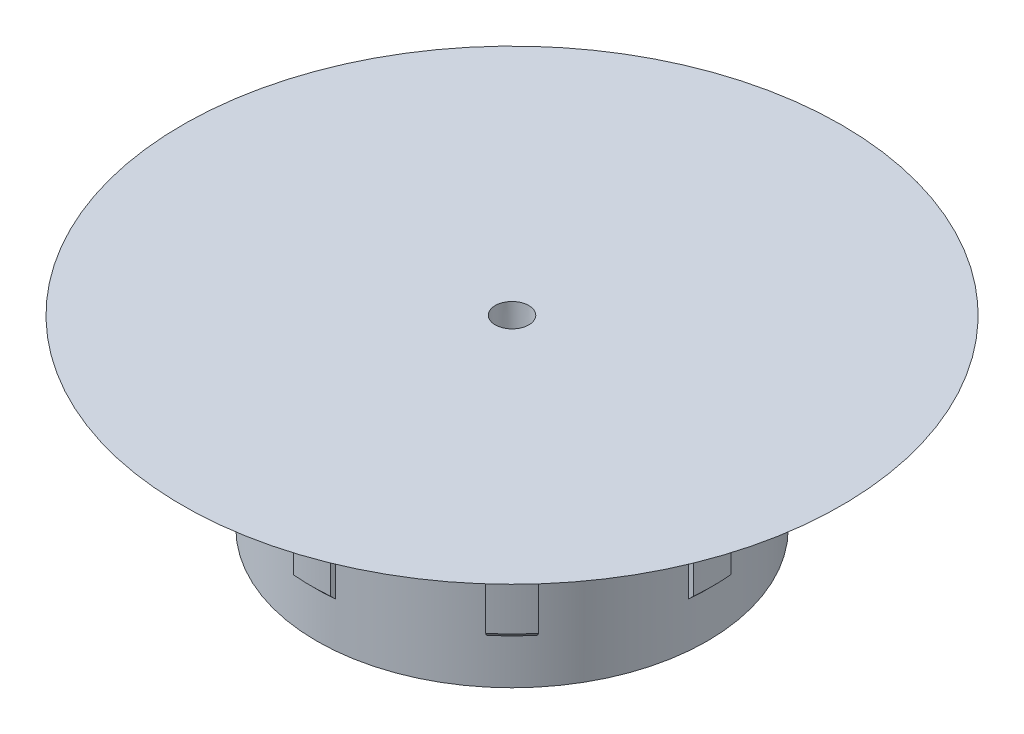
from build123d import *

# Parameters (mm, degrees)
SKETCH1_W          = 23.2283
SKETCH1_H          = 15.24
CUT_EXTRUDE1_START = -15.24
CUT_EXTRUDE1_DEPTH = 15.24
SKETCH3_R          = 1.6764
CUT_EXTRUDE2_DEPTH = 15.24
CUT_EXTRUDE3_START = -5.08
SKETCH4_R          = 23.2283
SKETCH4_R_2        = 22.5806
CUT_EXTRUDE3_DEPTH = 5.08
CHAMFER1_SIZE      = 0.762
DRAFT1_ANGLE       = 1


with BuildPart() as part:
    # Sketch1 → Revolve1 (revolve)
    with BuildSketch(Plane.XY, mode=Mode.PRIVATE) as revolve1_sk:
        with Locations((11.61415, 7.62)):
            Rectangle(SKETCH1_W, SKETCH1_H)
        Polygon((0, 21.336), (0, 15.24), (23.2283, 15.24), (38.1, 21.336), align=None)
    revolve(revolve1_sk.sketch.rotate(Axis((0, 0, 0), (0, 1, 0)), 90), axis=Axis((0, 0, 0), (0, 1, 0)))

    # Sketch2 → Cut-Extrude1 (cut)
    with BuildSketch(Plane.XZ.offset(CUT_EXTRUDE1_START)):
        with BuildLine():
            Line((2.159, 23.127746105), (2.09879825, 22.482849959))
            ThreePointArc((2.09879825, 22.482849959), (8.641221513, 20.861754172), (14.413701191, 17.381850141))
            Line((14.413701191, 17.381850141), (14.827142564, 17.880429645))
            ThreePointArc((14.827142564, 17.880429645), (8.889085572, 21.460150945), (2.159, 23.127746105))
        make_face()
        with BuildLine():
            ThreePointArc((-14.413701191, 17.381850141), (-8.641221513, 20.861754172), (-2.09879825, 22.482849959))
            Line((-2.09879825, 22.482849959), (-2.159, 23.127746105))
            ThreePointArc((-2.159, 23.127746105), (-8.889085572, 21.460150945), (-14.827142564, 17.880429645))
            Line((-14.827142564, 17.880429645), (-14.413701191, 17.381850141))
        make_face()
        with BuildLine():
            Line((-23.127746105, 2.159), (-22.482849959, 2.09879825))
            ThreePointArc((-22.482849959, 2.09879825), (-20.861754172, 8.641221513), (-17.381850141, 14.413701191))
            Line((-17.381850141, 14.413701191), (-17.880429645, 14.827142564))
            ThreePointArc((-17.880429645, 14.827142564), (-21.460150945, 8.889085572), (-23.127746105, 2.159))
        make_face()
        with BuildLine():
            Line((-17.880429645, -14.827142564), (-17.381850141, -14.413701191))
            ThreePointArc((-17.381850141, -14.413701191), (-20.861754172, -8.641221513), (-22.482849959, -2.09879825))
            Line((-22.482849959, -2.09879825), (-23.127746105, -2.159))
            ThreePointArc((-23.127746105, -2.159), (-21.460150945, -8.889085572), (-17.880429645, -14.827142564))
        make_face()
        with BuildLine():
            Line((-2.159, -23.127746105), (-2.09879825, -22.482849959))
            ThreePointArc((-2.09879825, -22.482849959), (-8.641221513, -20.861754172), (-14.413701191, -17.381850141))
            Line((-14.413701191, -17.381850141), (-14.827142564, -17.880429645))
            ThreePointArc((-14.827142564, -17.880429645), (-8.889085572, -21.460150945), (-2.159, -23.127746105))
        make_face()
        with BuildLine():
            Line((14.827142564, -17.880429645), (14.413701191, -17.381850141))
            ThreePointArc((14.413701191, -17.381850141), (8.641221513, -20.861754172), (2.09879825, -22.482849959))
            Line((2.09879825, -22.482849959), (2.159, -23.127746105))
            ThreePointArc((2.159, -23.127746105), (8.889085572, -21.460150945), (14.827142564, -17.880429645))
        make_face()
        with BuildLine():
            Line((23.127746105, -2.159), (22.482849959, -2.09879825))
            ThreePointArc((22.482849959, -2.09879825), (20.861754172, -8.641221513), (17.381850141, -14.413701191))
            Line((17.381850141, -14.413701191), (17.880429645, -14.827142564))
            ThreePointArc((17.880429645, -14.827142564), (21.460150945, -8.889085572), (23.127746105, -2.159))
        make_face()
        with BuildLine():
            Line((17.880429645, 14.827142564), (17.381850141, 14.413701191))
            ThreePointArc((17.381850141, 14.413701191), (20.861754172, 8.641221513), (22.482849959, 2.09879825))
            Line((22.482849959, 2.09879825), (23.127746105, 2.159))
            ThreePointArc((23.127746105, 2.159), (21.460150945, 8.889085572), (17.880429645, 14.827142564))
        make_face()
    extrude(amount=CUT_EXTRUDE1_DEPTH, mode=Mode.SUBTRACT)

    # Sketch3 → Cut-Extrude2 (cut)
    with BuildSketch(Plane(origin=(0, 21.336, 0), x_dir=(1, 0, 0), z_dir=(0, 1, 0))):
        with Locations(Location((0, 0, 0), (0, 0, 270))):
            Circle(SKETCH3_R)
    extrude(amount=-CUT_EXTRUDE2_DEPTH, mode=Mode.SUBTRACT)

    # Sketch4 → Cut-Extrude3 (cut)
    with BuildSketch(Plane.XZ.offset(CUT_EXTRUDE3_START)):
        Circle(SKETCH4_R)
        with Locations(Location((0, 0, 0), (0, 0, 270))):
            Circle(SKETCH4_R_2, mode=Mode.SUBTRACT)
    extrude(amount=CUT_EXTRUDE3_DEPTH, mode=Mode.SUBTRACT)

    # Chamfer1
    # the kernel refuses this chamfer: 0.762 mm, written as the material it takes off along each edge
    with BuildSketch(Plane(origin=(0, 5.08, 0), x_dir=(-0.17651563537313197, 0, -0.9842978362613723), z_dir=(-0.9842978362613723, 0, 0.17651563537313197))) as chamfer1_piece_1_section:
        Polygon((23.2283 - CHAMFER1_SIZE, 0), (23.2283, -CHAMFER1_SIZE), (23.2283, 0), align=None)
    chamfer1_piece_1 = revolve(axis=Axis((0, 5.08, 0), (0, -1, 0)), revolution_arc=20.333741592, mode=Mode.PRIVATE)
    chamfer1_piece_1 = chamfer1_piece_1 - Plane(origin=(0, 5.340057495, 0), x_dir=(0, 0, -1), z_dir=(0, 1, 0)) * Cylinder(22.5806, 93, mode=Mode.PRIVATE)
    add(chamfer1_piece_1, mode=Mode.SUBTRACT)
    with BuildSketch(Plane(origin=(0, 5.08, 0), x_dir=(0.5711882719698622, 0, -0.8208190774854607), z_dir=(-0.8208190774854607, 0, -0.5711882719698622))) as chamfer1_piece_2_section:
        Polygon((23.2283, -CHAMFER1_SIZE), (23.2283 - CHAMFER1_SIZE, 0), (23.2283, 0), align=None)
    chamfer1_piece_2 = revolve(axis=Axis((0, 5.08, 0), (0, -1, 0)), revolution_arc=20.333741592, mode=Mode.PRIVATE)
    chamfer1_piece_2 = chamfer1_piece_2 - Plane(origin=(0, 5.340057495, 0), x_dir=(0, 0, -1), z_dir=(0, 1, 0)) * Cylinder(22.5806, 93, mode=Mode.PRIVATE)
    add(chamfer1_piece_2, mode=Mode.SUBTRACT)
    with BuildSketch(Plane(origin=(0, 5.08, 0), x_dir=(0.9842978362613659, 0, -0.17651563537316883), z_dir=(-0.17651563537316883, 0, -0.9842978362613659))) as chamfer1_piece_3_section:
        Polygon((23.2283 - CHAMFER1_SIZE, 0), (23.2283, -CHAMFER1_SIZE), (23.2283, 0), align=None)
    chamfer1_piece_3 = revolve(axis=Axis((0, 5.08, 0), (0, -1, 0)), revolution_arc=20.333741592, mode=Mode.PRIVATE)
    chamfer1_piece_3 = chamfer1_piece_3 - Plane(origin=(0, 5.340057495, 0), x_dir=(0, 0, -1), z_dir=(0, 1, 0)) * Cylinder(22.5806, 93, mode=Mode.PRIVATE)
    add(chamfer1_piece_3, mode=Mode.SUBTRACT)
    with BuildSketch(Plane(origin=(0, 5.08, 0), x_dir=(0.8208190774854608, 0, 0.5711882719698618), z_dir=(0.5711882719698618, 0, -0.8208190774854608))) as chamfer1_piece_4_section:
        Polygon((23.2283 - CHAMFER1_SIZE, 0), (23.2283, -CHAMFER1_SIZE), (23.2283, 0), align=None)
    chamfer1_piece_4 = revolve(axis=Axis((0, 5.08, 0), (0, -1, 0)), revolution_arc=20.333741592, mode=Mode.PRIVATE)
    chamfer1_piece_4 = chamfer1_piece_4 - Plane(origin=(0, 5.340057495, 0), x_dir=(0, 0, -1), z_dir=(0, 1, 0)) * Cylinder(22.5806, 93, mode=Mode.PRIVATE)
    add(chamfer1_piece_4, mode=Mode.SUBTRACT)
    with BuildSketch(Plane(origin=(0, 5.08, 0), x_dir=(0.1765156353731264, 0, 0.9842978362613735), z_dir=(0.9842978362613735, 0, -0.1765156353731264))) as chamfer1_piece_5_section:
        Polygon((23.2283 - CHAMFER1_SIZE, 0), (23.2283, -CHAMFER1_SIZE), (23.2283, 0), align=None)
    chamfer1_piece_5 = revolve(axis=Axis((0, 5.08, 0), (0, -1, 0)), revolution_arc=20.333741592, mode=Mode.PRIVATE)
    chamfer1_piece_5 = chamfer1_piece_5 - Plane(origin=(0, 5.340057495, 0), x_dir=(0, 0, -1), z_dir=(0, 1, 0)) * Cylinder(22.5806, 93, mode=Mode.PRIVATE)
    add(chamfer1_piece_5, mode=Mode.SUBTRACT)
    with BuildSketch(Plane(origin=(0, 5.08, 0), x_dir=(-0.5711882719698653, 0, 0.8208190774854587), z_dir=(0.8208190774854587, 0, 0.5711882719698653))) as chamfer1_piece_6_section:
        Polygon((23.2283 - CHAMFER1_SIZE, 0), (23.2283, -CHAMFER1_SIZE), (23.2283, 0), align=None)
    chamfer1_piece_6 = revolve(axis=Axis((0, 5.08, 0), (0, -1, 0)), revolution_arc=20.333741592, mode=Mode.PRIVATE)
    chamfer1_piece_6 = chamfer1_piece_6 - Plane(origin=(0, 5.340057495, 0), x_dir=(0, 0, -1), z_dir=(0, 1, 0)) * Cylinder(22.5806, 93, mode=Mode.PRIVATE)
    add(chamfer1_piece_6, mode=Mode.SUBTRACT)
    with BuildSketch(Plane(origin=(0, 5.08, 0), x_dir=(-0.9842978362613705, 0, 0.17651563537314238), z_dir=(0.17651563537314238, 0, 0.9842978362613705))) as chamfer1_piece_7_section:
        Polygon((23.2283 - CHAMFER1_SIZE, 0), (23.2283, -CHAMFER1_SIZE), (23.2283, 0), align=None)
    chamfer1_piece_7 = revolve(axis=Axis((0, 5.08, 0), (0, -1, 0)), revolution_arc=20.333741592, mode=Mode.PRIVATE)
    chamfer1_piece_7 = chamfer1_piece_7 - Plane(origin=(0, 5.340057495, 0), x_dir=(0, 0, -1), z_dir=(0, 1, 0)) * Cylinder(22.5806, 93, mode=Mode.PRIVATE)
    add(chamfer1_piece_7, mode=Mode.SUBTRACT)
    with BuildSketch(Plane(origin=(0, 5.08, 0), x_dir=(-0.8208190774854607, 0, -0.5711882719698622), z_dir=(-0.5711882719698622, 0, 0.8208190774854607))) as chamfer1_piece_8_section:
        Polygon((23.2283 - CHAMFER1_SIZE, 0), (23.2283, -CHAMFER1_SIZE), (23.2283, 0), align=None)
    chamfer1_piece_8 = revolve(axis=Axis((0, 5.08, 0), (0, -1, 0)), revolution_arc=20.333741592, mode=Mode.PRIVATE)
    chamfer1_piece_8 = chamfer1_piece_8 - Plane(origin=(0, 5.340057495, 0), x_dir=(0, 0, -1), z_dir=(0, 1, 0)) * Cylinder(22.5806, 93, mode=Mode.PRIVATE)
    add(chamfer1_piece_8, mode=Mode.SUBTRACT)

    # Draft1
    draft1_faces = [part.faces().sort_by_distance(p)[0] for p in [
        (0, 13.716, -1.6764),
    ]]
    draft(draft1_faces, Plane.ZX.offset(6.096), DRAFT1_ANGLE)


solid = part.part
